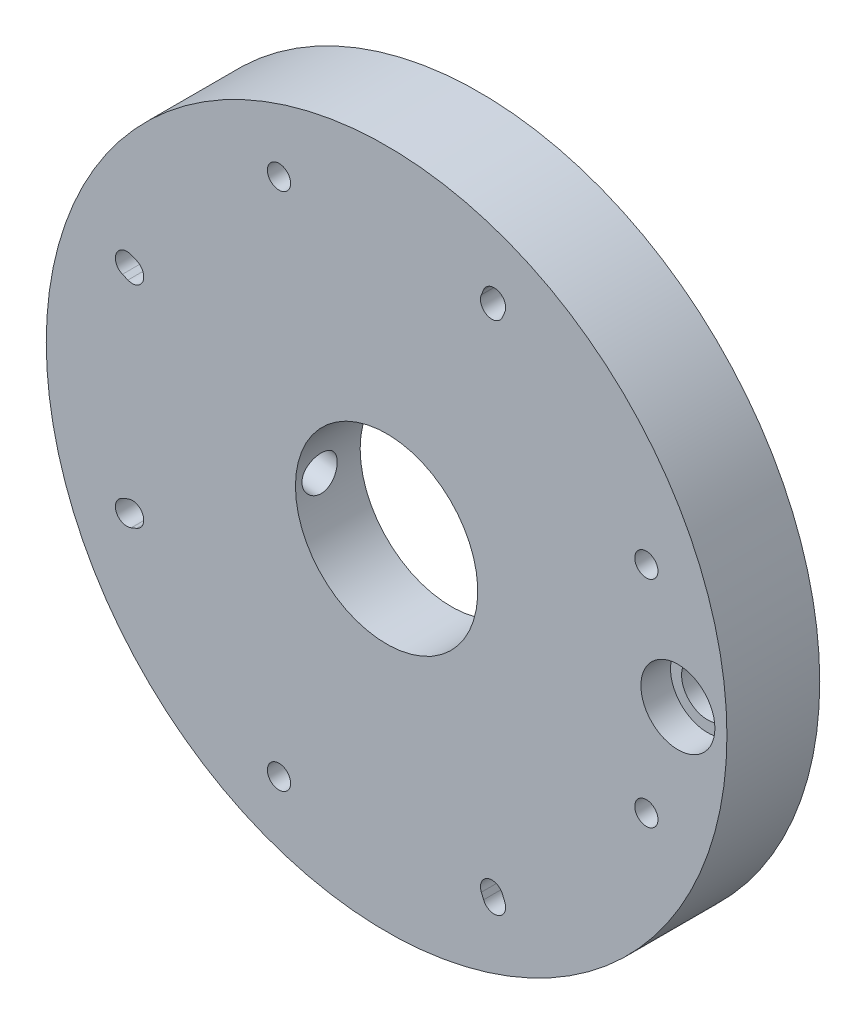
from build123d import *

# Parameters (mm, degrees)
CUT_EXTRUDE1_START                = 4.2164
SKETCH18_R                        = 57.15
CUT_EXTRUDE1_DEPTH                = 4.2164
PIPE_TAP_DRILL_FOR_3_8_TAP2_D     = 14.2748
PIPE_TAP_DRILL_FOR_3_8_TAP2_DEPTH = 16.158417418
PIPE_TAP_DRILL_FOR_3_8_TAP2_TIP   = 4.288582582
F_10_CLEARANCE_HOLE1_D            = 4.9784
CIRPATTERN1_COUNT                 = 8
CLEARANCING_START                 = -4.2164
SKETCH32_R                        = 73.025
CLEARANCING_DEPTH                 = 4.2164
F_10_START                        = 4.2164
F_10_0_1935_DIAMETER_SLOT1_DEPTH  = 19.9136
CIRPATTERN2_COUNT                 = 8


# Read off the part's stored shape, not the designer's step: #10 (0.1935) Diameter Slot1
with BuildPart() as part:
    # Sketch25 → Revolve1 (revolve)
    with BuildSketch(Plane(origin=(0, 0, 0), x_dir=(1, 0, 0), z_dir=(0, 1, 0))):
        Polygon((-19.558, -24.13), (-19.558, -10.24382), (-39.2684, -10.24382), (-39.2684, 0), (-57.15, 0), (-57.15, -4.2164), (-73.025, -4.2164), (-73.025, -24.13), align=None)
    revolve(axis=Axis((0, 0, -8.4836), (0, 0, 1)))

    # Sketch18 → Cut-Extrude1 (cut)
    with BuildSketch(Plane.XY.offset(CUT_EXTRUDE1_START)):
        Circle(SKETCH18_R)
        with BuildLine():
            add(Edge.make_bspline(
                [(41.089237213, 0), (41.091962531, -0.086157587), (41.097413749, -0.258491166), (41.10355964, -0.517077072), (41.10820678, -0.775748178), (41.11421023, -1.293415642), (41.109015311, -2.589274196), (41.017814103, -4.490313926), (40.7831208, -6.729807087), (40.462314107, -8.787506492), (40.037808727, -10.829994254), (39.510298345, -12.852043551), (38.880746853, -14.848458078), (38.15038378, -16.814086746), (37.320701547, -18.743836999), (36.393451781, -20.63268838), (35.370641466, -22.475705706), (34.254528452, -24.268052099), (33.047616433, -26.005001751), (31.752649319, -27.681952446), (30.372605018, -29.294437787), (28.910688618, -30.83813911), (27.370324987, -32.308897058), (25.755150794, -33.702722776), (24.069005972, -35.015808715), (22.315924639, -36.244539), (20.500125495, -37.385499343), (18.62600172, -38.435486481), (16.698110388, -39.3915171), (14.721161433, -40.250836227), (12.700006186, -41.010925075), (10.639625512, -41.669508306), (8.545117571, -42.224560694), (6.421685244, -42.674313186), (4.274623243, -43.017258312), (2.109304944, -43.252154961), (-0.068831028, -43.378032487), (-2.254294428, -43.394194133), (-4.441557201, -43.300219785), (-6.625067428, -43.095968006), (-8.799263397, -42.781577389), (-10.958587737, -42.35746718), (-13.097501591, -41.8243372), (-15.210498799, -41.183167044), (-17.292120038, -40.435214565), (-19.336966901, -39.582013644), (-21.339715858, -38.62537124), (-23.295132091, -37.567363743), (-25.198083132, -36.410332623), (-27.043552306, -35.156879378), (-28.826651909, -33.809859817), (-30.542636113, -32.372377659), (-32.186913551, -30.847777489), (-33.75505955, -29.239637062), (-35.242827981, -27.551758997), (-36.6461627, -25.788161864), (-37.961208531, -23.953070684), (-39.184321792, -22.050906876), (-40.312080298, -20.086277666), (-41.34129285, -18.063964982), (-42.269008156, -15.988913871), (-43.092523175, -13.866220454), (-43.809390856, -11.701119456), (-44.417427247, -9.498971339), (-44.914717965, -7.265249075), (-45.299623986, -5.005524575), (-45.570786769, -2.725454833), (-45.727132667, -0.430767795), (-45.767876634, 1.872751999), (-45.692525205, 4.179277959), (-45.500878745, 6.482956161), (-45.193032951, 8.777920163), (-44.76937961, 11.058305925), (-44.2306066, 13.318266753), (-43.577697135, 15.551988265), (-42.811928261, 17.753703317), (-41.934868588, 19.917706858), (-40.948375273, 22.038370685), (-39.854590259, 24.110158043), (-38.655935769, 26.127638043), (-37.35510908, 28.085499861), (-35.95507656, 29.978566677), (-34.45906702, 31.801809315), (-32.870564351, 33.550359561), (-31.193299507, 35.2195231), (-29.431241811, 36.804792072), (-27.58858964, 38.301857174), (-25.669760482, 39.706619311), (-23.67938041, 41.015200739), (-21.62227298, 42.22395569), (-19.503447594, 43.329480427), (-17.328087349, 44.32862273), (-15.101536401, 45.218490759), (-12.829286876, 45.996461288), (-10.51696536, 46.660187279), (-8.170319005, 47.207604779), (-5.795201275, 47.63693911), (-3.397557376, 47.946710349), (-0.983409407, 48.13573807), (1.441158736, 48.203145338), (3.870016668, 48.148361942), (6.297002983, 47.971126851), (8.715940862, 47.671489899), (11.120653763, 47.249812672), (13.504981164, 46.706768607), (15.862794321, 46.043342297), (18.188011992, 45.260827993), (20.47461609, 44.360827321), (22.71666723, 43.345246195), (24.908320125, 42.216290953), (27.043838787, 40.976463712), (29.117611505, 39.628556947), (31.12416555, 38.175647316), (33.058181574, 36.621088743), (34.914507669, 34.968504765), (36.688173034, 33.221780166), (38.374401232, 31.385051924), (39.968622994, 29.462699478), (41.466488529, 27.459334348), (42.863879321, 25.37978913), (44.156919368, 23.229105887), (45.341985843, 21.012523976), (46.415719137, 18.735467323), (47.152873419, 16.943563677), (47.537044371, 15.914838228), (47.625380995, 15.672606956)],
                knots=[0, 0, 0, 0, 0.000898736, 0.001797664, 0.002696784, 0.003596095, 0.007195255, 0.016206602, 0.023429565, 0.030664921, 0.03791271, 0.04517297, 0.052445735, 0.059731037, 0.067028905, 0.074339368, 0.081662453, 0.088998186, 0.096346593, 0.103707696, 0.111081519, 0.118468084, 0.125867414, 0.13327953, 0.140704451, 0.148142199, 0.155592793, 0.163056252, 0.170532595, 0.178021841, 0.185524007, 0.193039111, 0.200567171, 0.208108204, 0.215662226, 0.223229255, 0.230809306, 0.238402396, 0.24600854, 0.253627754, 0.261260054, 0.268905454, 0.27656397, 0.284235617, 0.291920409, 0.29961836, 0.307329485, 0.315053798, 0.322791313, 0.330542044, 0.338306004, 0.346083208, 0.353873668, 0.361677398, 0.369494411, 0.37732472, 0.385168337, 0.393025277, 0.400895551, 0.408779172, 0.416676152, 0.424586504, 0.432510241, 0.440447374, 0.448397915, 0.456361877, 0.464339271, 0.472330109, 0.480334403, 0.488352164, 0.496383405, 0.504428136, 0.512486369, 0.520558115, 0.528643386, 0.536742193, 0.544854546, 0.552980457, 0.561119937, 0.569272997, 0.577439648, 0.585619899, 0.593813763, 0.60202125, 0.61024237, 0.618477134, 0.626725552, 0.634987634, 0.643263392, 0.651552835, 0.659855974, 0.668172818, 0.676503379, 0.684847665, 0.693205688, 0.701577457, 0.709962981, 0.718362272, 0.726775338, 0.73520219, 0.743642837, 0.752097289, 0.760565555, 0.769047646, 0.777543571, 0.786053339, 0.79457696, 0.803114443, 0.811665798, 0.820231034, 0.828810161, 0.837403187, 0.846010122, 0.854630975, 0.863265756, 0.871914473, 0.880577136, 0.889253753, 0.897944334, 0.906648887, 0.915367423, 0.924099948, 0.932846474, 0.941607007, 0.944295232, 0.944295232, 0.944295232, 0.944295232], degree=3))
            ThreePointArc((47.625380995, 15.672606956), (47.687720846, 10.629001226), (44.585991464, 6.651424093))
            ThreePointArc((44.585991464, 6.651424093), (41.960682048, 3.786728615), (41.089237213, 0))
        make_face(mode=Mode.SUBTRACT)
    extrude(amount=-CUT_EXTRUDE1_DEPTH, mode=Mode.SUBTRACT)

    # Sketch20 → Turbine Shaft Hole (revolve, cut)
    with BuildSketch(Plane(origin=(0, 0, 0), x_dir=(1, 0, 0), z_dir=(0, 1, 0))):
        Polygon((62.5, -4.2164), (62.5, -24.13), (70.4375, -24.13), (70.4375, -17.78), (68.05625, -17.78), (68.05625, -4.2164), align=None)
    revolve(axis=Axis((62.5, 0, 24.13), (0, 0, -1)), mode=Mode.SUBTRACT)

    # Pipe Tap Drill for 3/8 Tap2
    with Locations(Plane(origin=(-73.025, 0, 14.605), x_dir=(0, 0, -1), z_dir=(-1, 0, 0))):
        with Locations((0, 0)):
            Hole(PIPE_TAP_DRILL_FOR_3_8_TAP2_D / 2, depth=PIPE_TAP_DRILL_FOR_3_8_TAP2_DEPTH)
            with Locations((0, 0, -(PIPE_TAP_DRILL_FOR_3_8_TAP2_DEPTH + PIPE_TAP_DRILL_FOR_3_8_TAP2_TIP / 2))):  # 118° drill point
                Cone(0, PIPE_TAP_DRILL_FOR_3_8_TAP2_D / 2, PIPE_TAP_DRILL_FOR_3_8_TAP2_TIP, mode=Mode.SUBTRACT)

    # #10 Clearance Hole1 (through all)
    with Locations(Plane(origin=(55.733032799, -23.085378057, 24.13), x_dir=(1, 0, 0), z_dir=(0, 0, 1))):
        with Locations((0, 0)):
            f_10_clearance_hole1 = Hole(F_10_CLEARANCE_HOLE1_D / 2)

    # CirPattern1: #10 Clearance Hole1 ×8 about axis, 4 skipped
    cirpattern1_axis = Axis((0, 0, 0), (0, 0, 1))
    add([f_10_clearance_hole1.rotate(cirpattern1_axis, i * 360 / CIRPATTERN1_COUNT) for i in range(1, CIRPATTERN1_COUNT) if i not in (2, 4, 5, 7)], mode=Mode.SUBTRACT)

    # Sketch30 → Cut-Revolve1 (revolve, cut)
    with BuildSketch(Plane(origin=(0, 0, 0), x_dir=(1, 0, 0), z_dir=(0, 1, 0))):
        Polygon((0, -20.834021296), (-73.025, -13.802513551), (-73.386368439, -17.55546828), (-0.361368439, -24.586976025), align=None)
    revolve(axis=Axis((-73.025, 0, 13.802513551), (0.9953961983671795, 0, 0.09584575252021674)), mode=Mode.SUBTRACT)

    # Sketch32 → Clearancing (cut)
    with BuildSketch(Plane(origin=(0, 0, 0), x_dir=(-1, 0, 0), z_dir=(0, 0, -1)).offset(CLEARANCING_START)):
        Circle(SKETCH32_R)
        with BuildLine():
            ThreePointArc((-47.506067229, 15.629095748), (-47.567368082, 10.669550114), (-44.51733419, 6.758265932))
            ThreePointArc((-44.51733419, 6.758265932), (-41.848269617, 3.845825531), (-40.962300701, -0.004015228))
            add(Edge.make_bspline(
                [(-40.962300701, -0.004015228), (-40.984829754, -0.716243545), (-40.991482345, -1.426292399), (-40.965808515, -2.841039211), (-40.934791994, -3.545916987), (-40.788046598, -5.65317915), (-40.449416827, -8.44323574), (-39.826992242, -11.194334019), (-39.251228801, -13.242702158), (-39.04041264, -13.924921757), (-38.586043887, -15.271416492), (-38.342460818, -15.936244836), (-37.044241995, -19.219159068), (-35.751111298, -21.714802599), (-33.817948717, -24.671739224), (-33.415325439, -25.254916955), (-32.577512865, -26.404553153), (-32.142989691, -26.969901223), (-30.805310798, -28.622109954), (-29.863742521, -29.67138319), (-27.88370287, -31.668321975), (-26.84522274, -32.615978344), (-25.214580249, -33.961000268), (-24.658855428, -34.396572383), (-23.52273746, -35.241850655), (-22.941371199, -35.652200602), (-19.982337143, -37.630798215), (-17.495723306, -38.952149767), (-13.594391809, -40.558687212), (-12.265158452, -41.031133778), (-10.227142901, -41.643055288), (-9.538560062, -41.831284287), (-8.159344959, -42.171675018), (-7.468051402, -42.324142065), (-4.003321953, -42.999606071), (-1.205332292, -43.264420661), (2.324696242, -43.253266134), (3.032343885, -43.233770306), (4.450976737, -43.159684207), (5.16260658, -43.104918353), (7.279359647, -42.889714494), (8.673993393, -42.678265993), (12.809724164, -41.845880015), (15.503095197, -41.028729387), (18.787939685, -39.670706521), (19.439945622, -39.382349429), (20.721782261, -38.777972555), (21.353348612, -38.461258619), (23.220466367, -37.468277477), (25.636538884, -36.03026989), (27.907728904, -34.367230475), (29.556019298, -33.034366172), (30.096251631, -32.575792031), (31.157992098, -31.629561277), (31.678275818, -31.142874487), (34.206194586, -28.662350465), (36.015531715, -26.510793678), (38.41831625, -23.039245987), (39.16701973, -21.841083162), (40.20957198, -19.98066895), (40.543029676, -19.350876534), (41.176251076, -18.083381709), (41.476896624, -17.444132119), (42.901648241, -14.220838418), (43.792349276, -11.556354365), (44.594692676, -8.118555948), (44.739484647, -7.425593495), (44.997193357, -6.028683216), (45.110048425, -5.324423569), (45.397284161, -3.217220036), (45.521950193, -1.812522973), (45.701086012, 2.401261181), (45.562340657, 5.210043831), (45.059447785, 8.720503026), (44.941902272, 9.424175437), (44.675570213, 10.818485677), (44.526710242, 11.510176401), (44.03392467, 13.569160455), (43.253850892, 16.271636591), (42.232110927, 18.889968175), (41.374523909, 20.821933821), (41.073427004, 21.460617921), (40.440358133, 22.727235888), (40.107694699, 23.35639756), (38.373818129, 26.460390162), (36.780750271, 28.78088885), (34.095328382, 32.027965174), (33.150564893, 33.07112628), (31.657831232, 34.576159768), (31.147637834, 35.06787246), (30.101580295, 36.031020228), (29.567134533, 36.501054535), (26.856787595, 38.778313639), (24.550582917, 40.384325472), (20.890041552, 42.47849974), (19.636115903, 43.123761403), (17.703471684, 44.01067886), (17.048967242, 44.293434078), (15.733188711, 44.827093949), (15.071549163, 45.078271992), (11.744943292, 46.257335392), (9.025190072, 46.956566279), (4.859147554, 47.644767103), (3.455979938, 47.813706456), (1.328883106, 47.973856364), (0.6186853, 48.011419961), (-0.796199225, 48.054972454), (-1.502092621, 48.06105803), (-5.023934167, 48.014237149), (-7.817182412, 47.731371248), (-11.278596108, 47.072391218), (-11.96936046, 46.925213328), (-13.347812594, 46.599690607), (-14.03708102, 46.420880282), (-16.087853103, 45.84036778), (-17.428630402, 45.396086399), (-21.374271765, 43.89689302), (-23.903005899, 42.67684778), (-26.936352555, 40.875077272), (-27.536597899, 40.500788916), (-28.724048455, 39.723926887), (-29.311972723, 39.320747942), (-31.039486686, 38.080104884), (-32.148213344, 37.208324215), (-35.349169758, 34.462697204), (-37.317082683, 32.459509238), (-39.567440801, 29.737522075), (-40.006964214, 29.18215008), (-40.86456786, 28.049096194), (-41.281778161, 27.472452922), (-42.490525828, 25.724130807), (-43.242666913, 24.529670436), (-45.341238448, 20.861286589), (-46.530959758, 18.302975659), (-47.506067229, 15.629095748)],
                knots=[0, 0, 0, 0, 0.0078125, 0.0078125, 0.015625, 0.015625, 0.03125, 0.046875, 0.046875, 0.0546875, 0.0546875, 0.0625, 0.0625, 0.09375, 0.09375, 0.1015625, 0.1015625, 0.109375, 0.109375, 0.125, 0.125, 0.140625, 0.140625, 0.1484375, 0.1484375, 0.15625, 0.15625, 0.1875, 0.1875, 0.203125, 0.203125, 0.2109375, 0.2109375, 0.21875, 0.21875, 0.25, 0.25, 0.2578125, 0.2578125, 0.265625, 0.265625, 0.28125, 0.28125, 0.3125, 0.3125, 0.3203125, 0.3203125, 0.328125, 0.328125, 0.34375, 0.359375, 0.359375, 0.3671875, 0.3671875, 0.375, 0.375, 0.40625, 0.40625, 0.421875, 0.421875, 0.4296875, 0.4296875, 0.4375, 0.4375, 0.46875, 0.46875, 0.4765625, 0.4765625, 0.484375, 0.484375, 0.5, 0.5, 0.53125, 0.53125, 0.5390625, 0.5390625, 0.546875, 0.546875, 0.5625, 0.578125, 0.578125, 0.5859375, 0.5859375, 0.59375, 0.59375, 0.625, 0.625, 0.640625, 0.640625, 0.6484375, 0.6484375, 0.65625, 0.65625, 0.6875, 0.6875, 0.703125, 0.703125, 0.7109375, 0.7109375, 0.71875, 0.71875, 0.75, 0.75, 0.765625, 0.765625, 0.7734375, 0.7734375, 0.78125, 0.78125, 0.8125, 0.8125, 0.8203125, 0.8203125, 0.828125, 0.828125, 0.84375, 0.84375, 0.875, 0.875, 0.8828125, 0.8828125, 0.890625, 0.890625, 0.90625, 0.90625, 0.9375, 0.9375, 0.9453125, 0.9453125, 0.953125, 0.953125, 0.96875, 0.96875, 1, 1, 1, 1], degree=3))
        make_face(mode=Mode.SUBTRACT)
    extrude(amount=CLEARANCING_DEPTH, mode=Mode.SUBTRACT)

    # #10 (0.1935) Diameter Slot1 outline → #10 (0.1935) Diameter Slot1 (cut)
    with BuildSketch(Plane.XY.offset(F_10_START)):
        with BuildLine():
            ThreePointArc((20.8149903, -56.6734582), (24.025803458, -58.003420556), (25.355765815, -54.792607398))
            Line((25.355765815, -54.792607398), (24.869757855, -53.619280392))
            ThreePointArc((24.869757855, -53.619280392), (21.658944697, -52.289318035), (20.328982341, -55.500131193))
            Line((20.328982341, -55.500131193), (20.8149903, -56.6734582))
        make_face()
    f_10_0_1935_diameter_slot1 = extrude(amount=F_10_0_1935_DIAMETER_SLOT1_DEPTH, mode=Mode.SUBTRACT)

    # CirPattern2: #10 (0.1935) Diameter Slot1 ×8 about axis, 4 skipped
    cirpattern2_axis = Axis((0, 0, -50.361336866), (0, 0, 1))
    add([f_10_0_1935_diameter_slot1.rotate(cirpattern2_axis, i * 360 / CIRPATTERN2_COUNT) for i in range(1, CIRPATTERN2_COUNT) if i not in (1, 2, 4, 7)], mode=Mode.SUBTRACT)


solid = part.part
